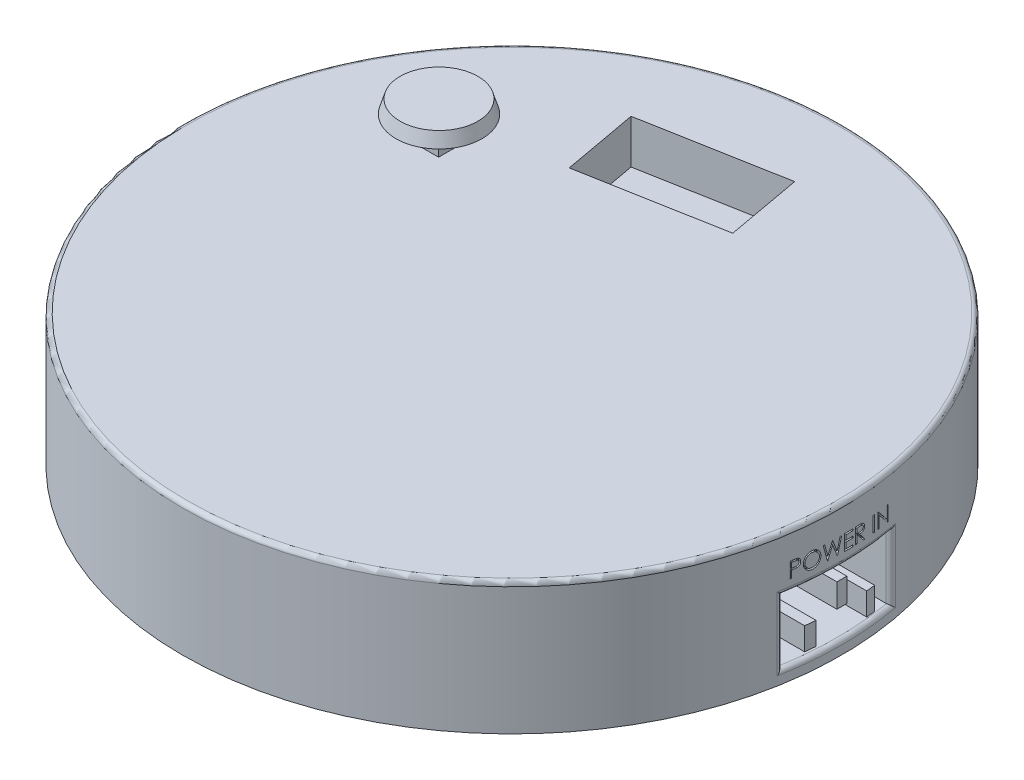
from build123d import *

# Parameters (mm, degrees)
SKETCH1_R           = 75
BOSS_EXTRUDE1_DEPTH = 30
SKETCH3_W           = 24.537422904
SKETCH3_H           = 14.580207812
SKETCH3_W_2         = 2.259802648
SKETCH3_H_2         = 5.400992927
SKETCH3_W_3         = 2.362763551
SKETCH3_H_3         = 5.147058637
SKETCH3_W_4         = 2.0252259
CUT_EXTRUDE1_DEPTH  = 20
FILLET2_R           = 1
SKETCH4_W           = 0.314102564
SKETCH4_H           = 3.5
CUT_EXTRUDE2_DEPTH  = 1
SKETCH5_W           = 11
SKETCH5_H           = 11
BOSS_EXTRUDE2_DEPTH = 3
SKETCH6_R           = 9.77107781
BOSS_EXTRUDE3_DEPTH = 3
BOSS_EXTRUDE3_TAPER = 17
FILLET5_R           = 1
CUT_EXTRUDE5_DEPTH  = 10


with BuildPart() as part:
    # Sketch1 → Boss-Extrude1 (new body)
    with BuildSketch(Plane(origin=(0, 0, 0), x_dir=(1, 0, 0), z_dir=(0, 1, 0))):
        with Locations(Location((0, 0, 0), (0, 0, 270))):
            Circle(SKETCH1_R)
    extrude(amount=BOSS_EXTRUDE1_DEPTH)

    # Sketch3 → Cut-Extrude1 (cut)
    with BuildSketch(Plane(origin=(75, 0, 0), x_dir=(0, 0, -1), z_dir=(1, 0, 0))):
        with Locations((0, 10.288103573)):
            Rectangle(SKETCH3_W, SKETCH3_H)
        with Locations((0.072945436, 12.273865005)):
            Rectangle(SKETCH3_W_2, SKETCH3_H_2, mode=Mode.SUBTRACT)
        with Locations((-6.79509594, 6.999839223)):
            Rectangle(SKETCH3_W_3, SKETCH3_H_3, mode=Mode.SUBTRACT)
        with Locations((6.9595633, 6.999839223)):
            Rectangle(SKETCH3_W_4, SKETCH3_H_3, mode=Mode.SUBTRACT)
    extrude(amount=-CUT_EXTRUDE1_DEPTH, mode=Mode.SUBTRACT)

    # Fillet2
    # the kernel refuses this fillet: 1 mm, written as the material it takes off along each edge
    with BuildSketch(Plane(origin=(0, 2.997999667, 0), x_dir=(0.9805297175756772, 0, -0.19637075380759422), z_dir=(-0.19637075380759422, 0, -0.9805297175756772))) as fillet2_piece_1_section:
        with BuildLine():
            CenterArc((75 - FILLET2_R, FILLET2_R), FILLET2_R, 270, 90)
            Line((75 - FILLET2_R, 0), (75, 0))
            Line((75, 0), (75, FILLET2_R))
        make_face()
    fillet2_piece_1 = revolve(axis=Axis((0, 2.997999667, 0), (0, -1, 0)), revolution_arc=22.649620693, mode=Mode.PRIVATE)
    fillet2_piece_1 = split(fillet2_piece_1, bisect_by=Plane(origin=(74.720156416, 2.718156083, 12.268711452), z_dir=(0, 0, -1)), keep=Keep.TOP, mode=Mode.PRIVATE)
    fillet2_piece_1 = split(fillet2_piece_1, bisect_by=Plane(origin=(74.720156416, 2.718156083, -12.268711452), z_dir=(0, 0, 1)), keep=Keep.TOP, mode=Mode.PRIVATE)
    add(fillet2_piece_1, mode=Mode.SUBTRACT)
    with BuildSketch(Plane(origin=(73.989720362, 17.578207479, 12.268711452), x_dir=(-0.17145032482367228, 0, 0.9851927659691059), z_dir=(0, -1, 0))) as fillet2_piece_2:
        with BuildLine():
            CenterArc((1.189051428, 0.999968158), FILLET2_R, 170.127845286, 100.329391973)
            Line((0.203858662, 1.171418482), (0, 0))
            ThreePointArc((0, 0), (0.59851582, -0.002388179), (1.197031639, 0))
        make_face()
    extrude(amount=14.580207812, mode=Mode.SUBTRACT)
    with BuildSketch(Plane(origin=(0, 17.578207479, 0), x_dir=(0.9805297175756772, 0, 0.19637075380759422), z_dir=(-0.19637075380759422, 0, 0.9805297175756772))) as fillet2_piece_3_section:
        with BuildLine():
            CenterArc((75 - FILLET2_R, FILLET2_R), FILLET2_R, 270, 90)
            Line((75 - FILLET2_R, 0), (75, 0))
            Line((75, 0), (75, FILLET2_R))
        make_face()
    fillet2_piece_3 = revolve(axis=Axis((0, 17.578207479, 0), (0, 1, 0)), revolution_arc=22.649620693, mode=Mode.PRIVATE)
    fillet2_piece_3 = split(fillet2_piece_3, bisect_by=Plane(origin=(74.720156416, 17.858051063, 12.268711452), z_dir=(0, 0, -1)), keep=Keep.TOP, mode=Mode.PRIVATE)
    fillet2_piece_3 = split(fillet2_piece_3, bisect_by=Plane(origin=(74.720156416, 17.858051063, -12.268711452), z_dir=(0, 0, 1)), keep=Keep.TOP, mode=Mode.PRIVATE)
    add(fillet2_piece_3, mode=Mode.SUBTRACT)
    with BuildSketch(Plane(origin=(73.989720362, 17.578207479, -12.268711452), x_dir=(-0.17145032482367276, 0, -0.9851927659691057), z_dir=(0, -1, 0))) as fillet2_piece_4:
        with BuildLine():
            CenterArc((1.189051428, -0.999968158), FILLET2_R, 89.542762741, 100.329391973)
            Line((0.203858662, -1.171418482), (0, 0))
            ThreePointArc((0, 0), (0.59851582, 0.002388179), (1.197031639, 0))
        make_face()
    extrude(amount=14.580207812, mode=Mode.SUBTRACT)
    with BuildSketch(Plane(origin=(0, 2.997999667, 0), x_dir=(0.9805297175756772, 0, -0.19637075380759422), z_dir=(-0.19637075380759422, 0, -0.9805297175756772))) as fillet2_piece_5a_section:
        with BuildLine():
            CenterArc((75 - FILLET2_R, FILLET2_R), FILLET2_R, 270, 90)
            Line((75 - FILLET2_R, 0), (75, 0))
            Line((75, 0), (75, FILLET2_R))
        make_face()
    fillet2_piece_5a = revolve(axis=Axis((0, 2.997999667, 0), (0, -1, 0)), revolution_arc=22.649620693, mode=Mode.PRIVATE)
    fillet2_piece_5a = split(fillet2_piece_5a, bisect_by=Plane(origin=(73.549350002, 2.769377091, -12.268711452), z_dir=(0, 0, -1)), keep=Keep.TOP, mode=Mode.PRIVATE)
    with BuildSketch(Plane(origin=(73.989720362, 17.578207479, -12.268711452), x_dir=(-0.17145032482367276, 0, -0.9851927659691057), z_dir=(0, -1, 0))) as fillet2_piece_5b_section:
        with BuildLine():
            CenterArc((1.189051428, -0.999968158), FILLET2_R, 89.542762741, 100.329391973)
            Line((0.203858662, -1.171418482), (0, 0))
            ThreePointArc((0, 0), (0.59851582, 0.002388179), (1.197031639, 0))
        make_face()
    fillet2_piece_5b = extrude(amount=17.57278691, mode=Mode.PRIVATE)
    fillet2_piece_5b = split(fillet2_piece_5b, bisect_by=Plane(origin=(73.668479479, 2.997999667, -12.542014518), z_dir=(0, -1, 0)), keep=Keep.TOP, mode=Mode.PRIVATE)
    fillet2_piece_5 = fillet2_piece_5a & fillet2_piece_5b
    add(fillet2_piece_5, mode=Mode.SUBTRACT)
    with BuildSketch(Plane(origin=(0, 2.997999667, 0), x_dir=(0.9805297175756772, 0, -0.19637075380759422), z_dir=(-0.19637075380759422, 0, -0.9805297175756772))) as fillet2_piece_6a_section:
        with BuildLine():
            CenterArc((75 - FILLET2_R, FILLET2_R), FILLET2_R, 270, 90)
            Line((75 - FILLET2_R, 0), (75, 0))
            Line((75, 0), (75, FILLET2_R))
        make_face()
    fillet2_piece_6a = revolve(axis=Axis((0, 2.997999667, 0), (0, -1, 0)), revolution_arc=22.649620693, mode=Mode.PRIVATE)
    fillet2_piece_6a = split(fillet2_piece_6a, bisect_by=Plane(origin=(73.549350275, 2.76937701, 12.268711452), z_dir=(0, 0, 1)), keep=Keep.TOP, mode=Mode.PRIVATE)
    with BuildSketch(Plane(origin=(73.989720362, 17.578207479, 12.268711452), x_dir=(-0.17145032482367228, 0, 0.9851927659691059), z_dir=(0, -1, 0))) as fillet2_piece_6b_section:
        with BuildLine():
            CenterArc((1.189051428, 0.999968158), FILLET2_R, 170.127845286, 100.329391973)
            Line((0.203858662, 1.171418482), (0, 0))
            ThreePointArc((0, 0), (0.59851582, -0.002388179), (1.197031639, 0))
        make_face()
    fillet2_piece_6b = extrude(amount=17.57278691, mode=Mode.PRIVATE)
    fillet2_piece_6b = split(fillet2_piece_6b, bisect_by=Plane(origin=(73.668479479, 2.997999667, 12.542014518), z_dir=(0, -1, 0)), keep=Keep.TOP, mode=Mode.PRIVATE)
    fillet2_piece_6 = fillet2_piece_6a & fillet2_piece_6b
    add(fillet2_piece_6, mode=Mode.SUBTRACT)
    with BuildSketch(Plane(origin=(0, 17.578207479, 0), x_dir=(0.9805297175756772, 0, 0.19637075380759422), z_dir=(-0.19637075380759422, 0, 0.9805297175756772))) as fillet2_piece_7a_section:
        with BuildLine():
            CenterArc((75 - FILLET2_R, FILLET2_R), FILLET2_R, 270, 90)
            Line((75 - FILLET2_R, 0), (75, 0))
            Line((75, 0), (75, FILLET2_R))
        make_face()
    fillet2_piece_7a = revolve(axis=Axis((0, 17.578207479, 0), (0, 1, 0)), revolution_arc=22.649620693, mode=Mode.PRIVATE)
    fillet2_piece_7a = split(fillet2_piece_7a, bisect_by=Plane(origin=(73.549350002, 17.806830055, 12.268711452), z_dir=(0, 0, 1)), keep=Keep.TOP, mode=Mode.PRIVATE)
    with BuildSketch(Plane(origin=(73.989720362, 20.570786577, 12.268711452), x_dir=(-0.17145032482367176, 0, 0.9851927659691059), z_dir=(0, -1, 0))) as fillet2_piece_7b_section:
        with BuildLine():
            CenterArc((1.189051428, 0.999968158), FILLET2_R, 170.127845286, 100.329391973)
            Line((0.203858662, 1.171418482), (0, 0))
            ThreePointArc((0, 0), (0.59851582, -0.002388179), (1.197031639, 0))
        make_face()
    fillet2_piece_7b = extrude(amount=17.57278691, mode=Mode.PRIVATE)
    fillet2_piece_7b = split(fillet2_piece_7b, bisect_by=Plane(origin=(73.668479479, 17.578207479, 12.542014518), z_dir=(0, 1, 0)), keep=Keep.TOP, mode=Mode.PRIVATE)
    fillet2_piece_7 = fillet2_piece_7a & fillet2_piece_7b
    add(fillet2_piece_7, mode=Mode.SUBTRACT)
    with BuildSketch(Plane(origin=(73.989720362, 20.570786577, -12.268711452), x_dir=(-0.17145032482367176, 0, -0.9851927659691059), z_dir=(0, -1, 0))) as fillet2_piece_8a_section:
        with BuildLine():
            CenterArc((1.189051428, -0.999968158), FILLET2_R, 89.542762741, 100.329391973)
            Line((0.203858662, -1.171418482), (0, 0))
            ThreePointArc((0, 0), (0.59851582, 0.002388179), (1.197031639, 0))
        make_face()
    fillet2_piece_8a = extrude(amount=17.57278691, mode=Mode.PRIVATE)
    fillet2_piece_8a = split(fillet2_piece_8a, bisect_by=Plane(origin=(73.668479479, 17.578207479, -12.542014518), z_dir=(0, 1, 0)), keep=Keep.TOP, mode=Mode.PRIVATE)
    with BuildSketch(Plane(origin=(0, 17.578207479, 0), x_dir=(0.9805297175756772, 0, 0.19637075380759422), z_dir=(-0.19637075380759422, 0, 0.9805297175756772))) as fillet2_piece_8b_section:
        with BuildLine():
            CenterArc((75 - FILLET2_R, FILLET2_R), FILLET2_R, 270, 90)
            Line((75 - FILLET2_R, 0), (75, 0))
            Line((75, 0), (75, FILLET2_R))
        make_face()
    fillet2_piece_8b = revolve(axis=Axis((0, 17.578207479, 0), (0, 1, 0)), revolution_arc=22.649620693, mode=Mode.PRIVATE)
    fillet2_piece_8b = split(fillet2_piece_8b, bisect_by=Plane(origin=(73.549350275, 17.806830135, -12.268711452), z_dir=(0, 0, -1)), keep=Keep.TOP, mode=Mode.PRIVATE)
    fillet2_piece_8 = fillet2_piece_8a & fillet2_piece_8b
    add(fillet2_piece_8, mode=Mode.SUBTRACT)

    # Sketch4 → Cut-Extrude2 (cut)
    # profile 1 of 7: a face of its own
    with BuildSketch(Plane(origin=(75, 0, 0), x_dir=(0, 0, -1), z_dir=(1, 0, 0))):
        with BuildLine():
            Line((-10.930956441, 23.567511252), (-10.244558204, 23.567511252))
            add(Edge.make_bspline(
                [(-10.244558204, 23.567511252), (-10.197347298, 23.567459356), (-10.106889105, 23.56735992), (-9.97717405, 23.564345174), (-9.859364318, 23.560318482), (-9.753713937, 23.554736589), (-9.659897839, 23.548139999), (-9.578340539, 23.538887959), (-9.508400983, 23.529227664), (-9.466494534, 23.519406257), (-9.447382724, 23.514927117)],
                knots=[0, 0, 0, 0, 1.415646017, 2.712440637, 3.8905458, 4.950247383, 5.884950622, 6.709939814, 7.411656543, 8, 8, 8, 8], degree=3))
            add(Edge.make_bspline(
                [(-9.447382724, 23.514927117), (-9.42318919, 23.508305167), (-9.375372213, 23.495217306), (-9.306471169, 23.469003582), (-9.240917324, 23.437921417), (-9.178485765, 23.402497477), (-9.119943682, 23.361211913), (-9.064417641, 23.315738295), (-9.012397661, 23.265026727), (-8.964176269, 23.209645987), (-8.919891472, 23.150525777), (-8.881761789, 23.086783547), (-8.849834562, 23.019492244), (-8.82245129, 22.948698673), (-8.802742836, 22.873808349), (-8.787895936, 22.795341637), (-8.778472309, 22.713306946), (-8.777569747, 22.657247079), (-8.777110288, 22.628709169)],
                knots=[0, 0, 0, 0, 0.999701418, 1.975846123, 2.934577507, 3.890451536, 4.834027766, 5.787354733, 6.749476667, 7.726910423, 8.712836071, 9.690891519, 10.682875813, 11.679750201, 12.712814741, 13.765529915, 14.8625177, 16, 16, 16, 16], degree=3))
            add(Edge.make_bspline(
                [(-8.777110288, 22.628709169), (-8.777531712, 22.599931392), (-8.778356258, 22.543625728), (-8.788252544, 22.46125294), (-8.801582735, 22.382534549), (-8.822079788, 22.307645099), (-8.848925461, 22.237029329), (-8.880417514, 22.169608097), (-8.918401044, 22.106528425), (-8.962045874, 22.047561307), (-9.010597468, 21.992651395), (-9.063850406, 21.9421966), (-9.121589699, 21.896492262), (-9.183631847, 21.855435918), (-9.250581696, 21.819979639), (-9.321423849, 21.788222334), (-9.396774066, 21.761551273), (-9.44891658, 21.747521212), (-9.475427595, 21.740387854)],
                knots=[0, 0, 0, 0, 1.121902311, 2.195077645, 3.232258892, 4.234102512, 5.217864754, 6.176164875, 7.132989551, 8.084763148, 9.034132444, 9.988522005, 10.94243251, 11.903244335, 12.886203696, 13.894208494, 14.929344452, 16, 16, 16, 16], degree=3))
            add(Edge.make_bspline(
                [(-9.475427595, 21.740387854), (-9.497354929, 21.735724873), (-9.545409957, 21.725505679), (-9.624552679, 21.714097222), (-9.716698065, 21.704359622), (-9.821720345, 21.697058484), (-9.93952525, 21.690808116), (-10.070176507, 21.685840022), (-10.213930584, 21.683110168), (-10.314201828, 21.682969375), (-10.366553397, 21.682895867)],
                knots=[0, 0, 0, 0, 0.601384939, 1.31797006, 2.144135048, 3.087295005, 4.142315834, 5.309527816, 6.595305764, 8, 8, 8, 8], degree=3))
            Line((-10.366553397, 21.682895867), (-10.616853877, 21.682895867))
            Line((-10.616853877, 21.682895867), (-10.616853877, 20.067511252))
            Line((-10.616853877, 20.067511252), (-10.930956441, 20.067511252))
            Line((-10.930956441, 20.067511252), (-10.930956441, 23.567511252))
        make_face()
        with BuildLine():
            Line((-10.616853877, 23.208536893), (-10.616853877, 22.041870226))
            Line((-10.616853877, 22.041870226), (-10.004073429, 22.034157886))
            add(Edge.make_bspline(
                [(-10.004073429, 22.034157886), (-9.974153503, 22.034142423), (-9.916393703, 22.034112571), (-9.83295748, 22.038097794), (-9.755548192, 22.042698327), (-9.684403617, 22.04943425), (-9.619491682, 22.058955508), (-9.560704154, 22.068567246), (-9.508496871, 22.082472608), (-9.447397669, 22.101195678), (-9.379314321, 22.133128293), (-9.305246773, 22.179478183), (-9.242476187, 22.238558891), (-9.18815789, 22.304986723), (-9.145052012, 22.378885852), (-9.11349602, 22.457954789), (-9.094954862, 22.541382638), (-9.092468669, 22.598470777), (-9.091212852, 22.627306925)],
                knots=[0, 0, 0, 0, 1.160613943, 2.240541288, 3.23993089, 4.169200891, 5.011653406, 5.7853311, 6.478053781, 7.106038997, 8.262395093, 9.384106736, 10.481365981, 11.59014053, 12.70357646, 13.786202915, 14.881775077, 16, 16, 16, 16], degree=3))
            add(Edge.make_bspline(
                [(-9.091212852, 22.627306925), (-9.092475498, 22.655445438), (-9.094985483, 22.711381321), (-9.113641346, 22.793360081), (-9.14499066, 22.871595786), (-9.188447255, 22.944568871), (-9.241188385, 23.010757675), (-9.302487728, 23.068254802), (-9.372200989, 23.114476505), (-9.43704922, 23.144309786), (-9.494650406, 23.162525062), (-9.544682366, 23.175269902), (-9.601173041, 23.185445508), (-9.66414082, 23.193685011), (-9.733097654, 23.200738472), (-9.808635969, 23.20552445), (-9.890469612, 23.208325906), (-9.947280183, 23.208464861), (-9.976729679, 23.208536893)],
                knots=[0, 0, 0, 0, 1.120700087, 2.227813068, 3.331159281, 4.466773991, 5.599788987, 6.693661531, 7.80175334, 8.91857717, 9.525282508, 10.207424825, 10.974604443, 11.810962634, 12.737642355, 13.736264703, 14.826523623, 16, 16, 16, 16], degree=3))
            Line((-9.976729679, 23.208536893), (-10.616853877, 23.208536893))
        make_face(mode=Mode.SUBTRACT)
    # profile 2 of 7: a face of its own
    with BuildSketch(Plane(origin=(75, 0, 0), x_dir=(0, 0, -1), z_dir=(1, 0, 0))):
        with BuildLine():
            add(Edge.make_bspline(
                [(-6.421341057, 23.657254842), (-6.356532951, 23.655613362), (-6.229244484, 23.652389361), (-6.042169586, 23.627710258), (-5.863574491, 23.585014868), (-5.692004352, 23.528151885), (-5.529511376, 23.4522975), (-5.374872483, 23.360612352), (-5.228455609, 23.252135893), (-5.092234228, 23.127706666), (-4.967577277, 22.992323212), (-4.857751391, 22.847845302), (-4.765709097, 22.6951465), (-4.69012331, 22.534685669), (-4.630824701, 22.366825701), (-4.589905657, 22.190671698), (-4.563767507, 22.007365008), (-4.560711729, 21.882338144), (-4.55916157, 21.818913495)],
                knots=[0, 0, 0, 0, 1.065120563, 2.091984664, 3.0946048, 4.079830382, 5.057816894, 6.036188127, 7.030412546, 8.04752943, 9.064399622, 10.05169764, 11.02544977, 11.989514704, 12.962713494, 13.945757189, 14.957906945, 16, 16, 16, 16], degree=3))
            add(Edge.make_bspline(
                [(-4.55916157, 21.818913495), (-4.560711502, 21.755956049), (-4.563766599, 21.631859629), (-4.589935376, 21.449716185), (-4.630976376, 21.274625488), (-4.689572642, 21.106879835), (-4.764798121, 20.946302271), (-4.857453292, 20.793315318), (-4.966594503, 20.647868819), (-5.090801354, 20.511556154), (-5.226202396, 20.386558683), (-5.371432663, 20.277639808), (-5.523225983, 20.183915683), (-5.683535691, 20.109132009), (-5.850235728, 20.049360089), (-6.024818051, 20.008607459), (-6.206464605, 19.982320415), (-6.330335608, 19.979301899), (-6.393296185, 19.977767662)],
                knots=[0, 0, 0, 0, 1.043624062, 2.057103931, 3.04512605, 4.022047818, 4.998200453, 5.980619268, 6.982898556, 8.009068085, 9.034988726, 10.034168286, 11.015286542, 11.987931943, 12.962482838, 13.94673481, 14.956375938, 16, 16, 16, 16], degree=3))
            add(Edge.make_bspline(
                [(-6.393296185, 19.977767662), (-6.456720504, 19.979317049), (-6.58174672, 19.982371303), (-6.765283755, 20.008552708), (-6.941561499, 20.049494012), (-7.11007585, 20.108003448), (-7.27092078, 20.183620678), (-7.424410863, 20.275825058), (-7.56993001, 20.385232199), (-7.706271756, 20.509398773), (-7.831020955, 20.644570325), (-7.93978033, 20.78940458), (-8.032005444, 20.941060037), (-8.107368776, 21.099957561), (-8.167033235, 21.265329004), (-8.207738054, 21.438277481), (-8.234074006, 21.617816987), (-8.237108852, 21.740059885), (-8.238648749, 21.802086572)],
                knots=[0, 0, 0, 0, 1.053102029, 2.075944431, 3.073151272, 4.055350789, 5.033113405, 6.020478099, 7.024410459, 8.052272461, 9.079885166, 10.07527673, 11.055994387, 12.023226415, 12.992069828, 13.970394897, 14.97016774, 16, 16, 16, 16], degree=3))
            add(Edge.make_bspline(
                [(-8.238648749, 21.802086572), (-8.238114114, 21.843719242), (-8.237051587, 21.926459365), (-8.224259895, 22.049325965), (-8.205698194, 22.170216623), (-8.179096281, 22.288787571), (-8.144304614, 22.404748556), (-8.103252587, 22.518899318), (-8.053112741, 22.630083042), (-7.996432093, 22.738826434), (-7.933170285, 22.84343434), (-7.863294536, 22.942313923), (-7.789259167, 23.03629492), (-7.708095774, 23.122941924), (-7.622479329, 23.20477558), (-7.53102095, 23.280538297), (-7.434278706, 23.350913248), (-7.331836326, 23.414333589), (-7.226218051, 23.471692724), (-7.117341274, 23.520914575), (-7.006684702, 23.563160636), (-6.893730054, 23.597401461), (-6.778777282, 23.624433497), (-6.661575498, 23.642840851), (-6.542218071, 23.655665169), (-6.461806752, 23.656722671), (-6.421341057, 23.657254842)],
                knots=[0, 0, 0, 0, 1.037015668, 2.060948919, 3.074880161, 4.083647147, 5.086022904, 6.090072063, 7.104153813, 8.122640571, 9.144368836, 10.147691507, 11.138137339, 12.123020368, 13.103399296, 14.087645067, 15.080126199, 16.082011238, 17.087798457, 18.072939717, 19.057185487, 20.037253025, 21.01195951, 21.997135196, 22.992090687, 24, 24, 24, 24], degree=3))
        make_face()
        with BuildLine():
            add(Edge.make_bspline(
                [(-6.405916377, 23.298280483), (-6.439131011, 23.297875592), (-6.505242744, 23.297069683), (-6.60352728, 23.286453967), (-6.700519214, 23.271324078), (-6.796238576, 23.249742557), (-6.890284865, 23.220338505), (-6.983534707, 23.186497596), (-7.075137761, 23.145276506), (-7.164791618, 23.098703801), (-7.251706694, 23.047154881), (-7.333719395, 22.990183114), (-7.411042039, 22.929124559), (-7.483485306, 22.863836722), (-7.550836478, 22.79398712), (-7.614421179, 22.720634684), (-7.671690761, 22.641682793), (-7.724176338, 22.559272386), (-7.771144178, 22.473510805), (-7.812909533, 22.385300943), (-7.847073541, 22.293923256), (-7.874935918, 22.200369098), (-7.898035729, 22.104786639), (-7.912669653, 22.00645079), (-7.923402012, 21.905855678), (-7.924161858, 21.837873824), (-7.924546185, 21.803488816)],
                knots=[0, 0, 0, 0, 1.008559885, 2.007477868, 2.99961109, 3.989939068, 4.984837346, 5.991145699, 7.001802488, 8.033829008, 9.059044045, 10.069351652, 11.065060232, 12.050310815, 13.029377138, 14.011219647, 14.996725999, 15.989392538, 16.977580475, 17.965360261, 18.951710183, 19.937753436, 20.929683414, 21.935841486, 22.955955122, 24, 24, 24, 24], degree=3))
            add(Edge.make_bspline(
                [(-7.924546185, 21.803488816), (-7.923271323, 21.752926595), (-7.920763275, 21.653455065), (-7.898805705, 21.507686921), (-7.864983731, 21.367598635), (-7.815126364, 21.233956725), (-7.75277575, 21.105612443), (-7.675748859, 20.983704338), (-7.584489774, 20.868199464), (-7.480826247, 20.759904195), (-7.367503541, 20.66105839), (-7.247170811, 20.574294982), (-7.121117203, 20.500884732), (-6.989014, 20.441079659), (-6.851566461, 20.393689922), (-6.70788891, 20.361211291), (-6.558938451, 20.339835835), (-6.457407796, 20.337783079), (-6.405916377, 20.336742021)],
                knots=[0, 0, 0, 0, 1.032063989, 2.030389145, 3.003944642, 3.970395727, 4.937377036, 5.913328081, 6.909231446, 7.93887556, 8.970685674, 9.976071282, 10.964166581, 11.944589148, 12.933237628, 13.927779006, 14.949070134, 16, 16, 16, 16], degree=3))
            add(Edge.make_bspline(
                [(-6.405916377, 20.336742021), (-6.371306876, 20.337217525), (-6.302665839, 20.338160593), (-6.200570317, 20.34765927), (-6.100314105, 20.36289114), (-6.002037825, 20.384821795), (-5.905853014, 20.412269002), (-5.811358211, 20.44487673), (-5.719559921, 20.485557933), (-5.629300083, 20.530505885), (-5.542903841, 20.581746042), (-5.460428309, 20.636784192), (-5.383952329, 20.697752813), (-5.311563258, 20.762070625), (-5.243935569, 20.831034473), (-5.181526584, 20.904554695), (-5.124546452, 20.983095352), (-5.072080806, 21.065380758), (-5.025277543, 21.151377011), (-4.984498444, 21.239906689), (-4.949902328, 21.330751798), (-4.921973823, 21.42404337), (-4.900088361, 21.519604218), (-4.885008441, 21.617562296), (-4.874460003, 21.717721639), (-4.873664926, 21.785465495), (-4.873264134, 21.819614617)],
                knots=[0, 0, 0, 0, 1.047197238, 2.076906641, 3.100256066, 4.114471768, 5.12198147, 6.126382909, 7.136867548, 8.15857795, 9.17633901, 10.174870724, 11.156907918, 12.133735059, 13.104061851, 14.077631395, 15.04955518, 16.038496417, 17.029181396, 18.010275684, 18.986308667, 19.968651475, 20.955262928, 21.950658345, 22.966943676, 24, 24, 24, 24], degree=3))
            add(Edge.make_bspline(
                [(-4.873264134, 21.819614617), (-4.873665247, 21.853530122), (-4.874460928, 21.920807772), (-4.885003403, 22.02026859), (-4.900104293, 22.117521802), (-4.921867001, 22.212185605), (-4.949917155, 22.30428413), (-4.984504485, 22.393730877), (-5.025289785, 22.480859072), (-5.072098009, 22.565453369), (-5.124713833, 22.646628107), (-5.182208076, 22.72423052), (-5.245573424, 22.796803261), (-5.312999449, 22.866137955), (-5.386170334, 22.930755845), (-5.464754628, 22.990678366), (-5.547798306, 23.04735164), (-5.635725542, 23.098477202), (-5.726469495, 23.145691434), (-5.819583453, 23.186142438), (-5.914012553, 23.220514557), (-6.009516665, 23.249831522), (-6.106899644, 23.271239552), (-6.205503472, 23.286467602), (-6.305191731, 23.297065988), (-6.372234951, 23.297874366), (-6.405916377, 23.298280483)],
                knots=[0, 0, 0, 0, 1.02996197, 2.043119294, 3.035359645, 4.018872909, 4.991431989, 5.957985074, 6.929999688, 7.912076566, 8.892894881, 9.867085534, 10.843653904, 11.817741046, 12.803660682, 13.806313499, 14.818574707, 15.856120519, 16.894564902, 17.924820532, 18.937903209, 19.946497019, 20.957711757, 21.963978472, 22.977135795, 24, 24, 24, 24], degree=3))
        make_face(mode=Mode.SUBTRACT)
    # profile 3 of 7: a face of its own
    with BuildSketch(Plane(origin=(75, 0, 0), x_dir=(0, 0, -1), z_dir=(1, 0, 0))):
        Polygon((-4.065571826, 23.567511252), (-3.741653557, 23.567511252), (-3.055956441, 20.998600995), (-2.037927595, 23.567511252), (-1.992354679, 23.567511252), (-0.991853877, 21.018232406), (-0.303352275, 23.567511252), (0.017761507, 23.567511252), (-0.925948429, 20.067511252), (-0.970820224, 20.067511252), (-2.023905159, 22.742992021), (-3.088208044, 20.067511252), (-3.133780961, 20.067511252), align=None)
    # profile 4 of 7: a face of its own
    with BuildSketch(Plane(origin=(75, 0, 0), x_dir=(0, 0, -1), z_dir=(1, 0, 0))):
        Polygon((0.645966635, 23.567511252), (2.62032561, 23.567511252), (2.62032561, 23.208536893), (0.9600692, 23.208536893), (0.9600692, 22.131613816), (2.62032561, 22.131613816), (2.62032561, 21.772639457), (0.9600692, 21.772639457), (0.9600692, 20.426485611), (2.62032561, 20.426485611), (2.62032561, 20.067511252), (0.645966635, 20.067511252), align=None)
    # profile 5 of 7: a face of its own
    with BuildSketch(Plane(origin=(75, 0, 0), x_dir=(0, 0, -1), z_dir=(1, 0, 0))):
        with BuildLine():
            Line((3.248530738, 23.567511252), (3.948951411, 23.567511252))
            add(Edge.make_bspline(
                [(3.948951411, 23.567511252), (3.99569254, 23.567355666), (4.085440684, 23.567056924), (4.214013954, 23.565391161), (4.330841051, 23.560616805), (4.435860891, 23.556508221), (4.529071546, 23.54901628), (4.610758836, 23.541855633), (4.680546534, 23.532481972), (4.722792385, 23.523776549), (4.741920161, 23.51983497)],
                knots=[0, 0, 0, 0, 1.410062039, 2.707475311, 3.878576406, 4.937260626, 5.877586885, 6.699081471, 7.410979367, 8, 8, 8, 8], degree=3))
            add(Edge.make_bspline(
                [(4.741920161, 23.51983497), (4.767526785, 23.513508204), (4.818193775, 23.500989641), (4.891143841, 23.47453004), (4.960658165, 23.443910415), (5.026447989, 23.407946695), (5.08818378, 23.366371915), (5.146502091, 23.319903793), (5.201667554, 23.268796587), (5.251449185, 23.211761746), (5.298388236, 23.151925236), (5.337976863, 23.087221479), (5.372103342, 23.019559952), (5.399273859, 22.948252534), (5.421151833, 22.873990762), (5.436578072, 22.796101965), (5.44582926, 22.71494099), (5.446771116, 22.659583081), (5.447248687, 22.631513656)],
                knots=[0, 0, 0, 0, 1.027469482, 2.033020251, 3.019912614, 3.986113645, 4.951240523, 5.91722682, 6.890402269, 7.87763091, 8.8651537, 9.85103654, 10.82876324, 11.815024772, 12.821070561, 13.842952187, 14.906261191, 16, 16, 16, 16], degree=3))
            add(Edge.make_bspline(
                [(5.447248687, 22.631513656), (5.445779689, 22.584878551), (5.442913293, 22.493881383), (5.416188189, 22.361820502), (5.372411669, 22.238631187), (5.31208838, 22.124468549), (5.235268905, 22.021557904), (5.142944114, 21.931167449), (5.035062502, 21.855527536), (4.934633186, 21.803074731), (4.845918986, 21.769481823), (4.772885674, 21.745845464), (4.693218696, 21.727583499), (4.607681362, 21.711223367), (4.515917706, 21.698871672), (4.418147667, 21.689825078), (4.314301515, 21.684171029), (4.242962446, 21.683329024), (4.20626311, 21.682895867)],
                knots=[0, 0, 0, 0, 1.260483769, 2.459530307, 3.627416485, 4.787058657, 5.939039949, 7.08810263, 8.267026773, 9.491475466, 10.141966685, 10.831826277, 11.566392101, 12.351337768, 13.187381173, 14.07005841, 15.007169909, 16, 16, 16, 16], degree=3))
            Line((4.20626311, 21.682895867), (5.492120482, 20.067511252))
            Line((5.492120482, 20.067511252), (5.103699007, 20.067511252))
            Line((5.103699007, 20.067511252), (3.817841635, 21.682895867))
            Line((3.817841635, 21.682895867), (3.562633302, 21.682895867))
            Line((3.562633302, 21.682895867), (3.562633302, 20.067511252))
            Line((3.562633302, 20.067511252), (3.248530738, 20.067511252))
            Line((3.248530738, 20.067511252), (3.248530738, 23.567511252))
        make_face()
        with BuildLine():
            Line((3.562633302, 23.208536893), (3.562633302, 22.041870226))
            Line((3.562633302, 22.041870226), (4.203458623, 22.036962374))
            add(Edge.make_bspline(
                [(4.203458623, 22.036962374), (4.233378662, 22.036949137), (4.291372219, 22.036923481), (4.375272883, 22.040917257), (4.453392995, 22.045460575), (4.525433747, 22.052409921), (4.591427323, 22.061365992), (4.651340736, 22.072568977), (4.705271788, 22.085621039), (4.768170326, 22.105822665), (4.838406858, 22.137828683), (4.914738317, 22.184394182), (4.979740655, 22.242963301), (5.034658518, 22.309936757), (5.078787949, 22.383573006), (5.109900003, 22.462989375), (5.129642446, 22.546180973), (5.131970991, 22.603359081), (5.133146123, 22.632214778)],
                knots=[0, 0, 0, 0, 1.146690395, 2.22261258, 3.21895312, 4.145990853, 4.996080663, 5.770904154, 6.481378293, 7.121626537, 8.300444488, 9.431385265, 10.535395872, 11.636531494, 12.74115979, 13.810798291, 14.895190096, 16, 16, 16, 16], degree=3))
            add(Edge.make_bspline(
                [(5.133146123, 22.632214778), (5.131944002, 22.660361351), (5.129561836, 22.71613759), (5.110113068, 22.7977935), (5.077223686, 22.87486045), (5.032901448, 22.947024935), (4.978902293, 23.012530671), (4.915584481, 23.068577824), (4.844679286, 23.114827289), (4.778408087, 23.144381669), (4.719173875, 23.162501523), (4.667744215, 23.175252686), (4.609632737, 23.185497155), (4.544557278, 23.193705216), (4.472795648, 23.200760161), (4.393984996, 23.205511939), (4.308648216, 23.208325803), (4.249501285, 23.208464892), (4.218883302, 23.208536893)],
                knots=[0, 0, 0, 0, 1.101028733, 2.181837193, 3.264309656, 4.369019818, 5.486613113, 6.575447106, 7.666700264, 8.788928104, 9.402425223, 10.0903467, 10.862060571, 11.710948788, 12.657782767, 13.684531032, 14.801375019, 16, 16, 16, 16], degree=3))
            Line((4.218883302, 23.208536893), (3.562633302, 23.208536893))
        make_face(mode=Mode.SUBTRACT)
    # profile 6 of 7: a face of its own
    with BuildSketch(Plane(origin=(75, 0, 0), x_dir=(0, 0, -1), z_dir=(1, 0, 0))):
        with Locations((7.713274328, 21.817511252)):
            Rectangle(SKETCH4_W, SKETCH4_H)
    # profile 7 of 7: a face of its own
    with BuildSketch(Plane(origin=(75, 0, 0), x_dir=(0, 0, -1), z_dir=(1, 0, 0))):
        Polygon((8.767761507, 20.067511252), (8.767761507, 23.567511252), (8.833666956, 23.567511252), (11.145966635, 20.81280372), (11.145966635, 23.567511252), (11.4600692, 23.567511252), (11.4600692, 20.067511252), (11.388554776, 20.067511252), (9.081864071, 22.815908688), (9.081864071, 20.067511252), align=None)
    extrude(amount=-CUT_EXTRUDE2_DEPTH, mode=Mode.SUBTRACT)

    # Sketch5 → Boss-Extrude2 (add)
    with BuildSketch(Plane(origin=(0, 30, 0), x_dir=(1, 0, 0), z_dir=(0, 1, 0))):
        with Locations((-44.488514631, 27.787282784)):
            Rectangle(SKETCH5_W, SKETCH5_H)
    extrude(amount=BOSS_EXTRUDE2_DEPTH)

    # Sketch6 → Boss-Extrude3 (add)
    with BuildSketch(Plane(origin=(0, 33, 0), x_dir=(1, 0, 0), z_dir=(0, 1, 0))):
        with Locations((-44.463477813, 27.848344097)):
            Circle(SKETCH6_R)
    extrude(amount=BOSS_EXTRUDE3_DEPTH, taper=BOSS_EXTRUDE3_TAPER)

    # Fillet5
    fillet5_edges = [part.edges().sort_by_distance(p)[0] for p in [
        (0, 30, -75),
    ]]
    fillet(fillet5_edges, radius=FILLET5_R)

    # Sketch11 → Cut-Extrude5 (cut)
    with BuildSketch(Plane(origin=(0, 30, 0), x_dir=(1, 0, 0), z_dir=(0, 1, 0))):
        Polygon((-25.154243082, 52.253197861), (6.326638664, 57.993762685), (9.466010052, 40.77765548), (-22.014871694, 35.037090657), align=None)
    extrude(amount=-CUT_EXTRUDE5_DEPTH, mode=Mode.SUBTRACT)


solid = part.part
